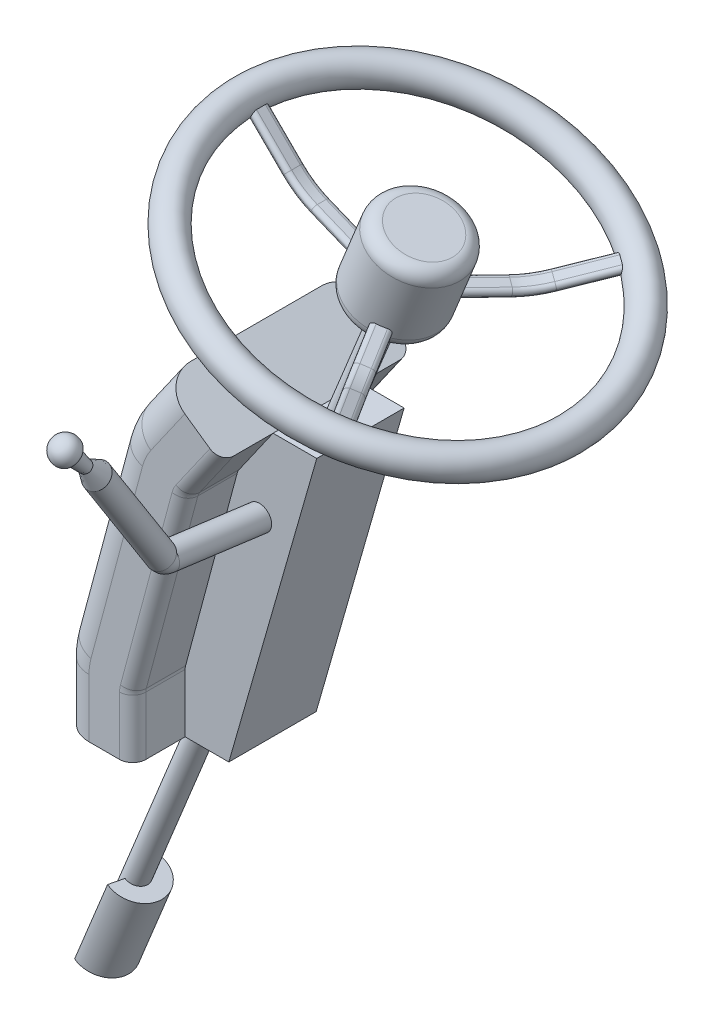
from build123d import *

# Parameters (mm, degrees)
EXTRUDE_THIN1_DEPTH      = 110
FILLET1_R                = 35
FILLET2_R                = 15
BOSS_EXTRUDE1_DEPTH      = 50
BOSS_EXTRUDE2_DEPTH      = 729
BOSS_EXTRUDE2_DEPTH_BACK = 150
SKETCH3_R                = 12.5
SKETCH4_R                = 17.5
FILLET3_R                = 15
EXTRUDE_THIN2_DEPTH      = 10
FILLET4_R                = 5
CIRPATTERN1_COUNT        = 3
FILLET4_OF_CIRPATTERN1_R = 5
BOSS_EXTRUDE3_START      = -10
BOSS_EXTRUDE3_DEPTH      = 100
SKETCH7_R                = 14


with BuildPart() as part:
    # Sketch1 → Extrude-Thin1 (new, symmetric)
    with BuildSketch(Plane.XY):
        with BuildLine():
            Line((0, 0), (0, 66.834750241))
            ThreePointArc((0, 66.834750241), (0.855513863, 79.887369463), (3.407417371, 92.716654752))
            Line((3.407417371, 92.716654752), (62.423620031, 312.968121546))
            ThreePointArc((62.423620031, 312.968121546), (68.385423956, 329.34804321), (77.100998231, 344.443860671))
            Line((77.100998231, 344.443860671), (116.001825782, 400))
            Line((116.001825782, 400), (185.629749547, 351.24600291))
            Line((185.629749547, 351.24600291), (146.728921995, 295.689863581))
            ThreePointArc((146.728921995, 295.689863581), (145.421585854, 293.425490962), (144.527315265, 290.968502712))
            Line((144.527315265, 290.968502712), (85.511112606, 70.717035918))
            ThreePointArc((85.511112606, 70.717035918), (85.128327079, 68.792643125), (85, 66.834750241))
            Line((85, 66.834750241), (85, 0))
            Line((85, 0), (0, 0))
        make_face()
    extrude(amount=EXTRUDE_THIN1_DEPTH, both=True)

    # Fillet1
    fillet1_edges = [part.edges().sort_by_distance(p)[0] for p in [
        (96.551412006, 372.221930336, 110),
        (0, 33.417375121, -110),
        (0.855513863, 79.887369463, -110),
        (32.915518701, 202.842388149, -110),
        (68.385423956, 329.34804321, -110),
        (96.551412006, 372.221930336, -110),
        (68.385423956, 329.34804321, 110),
        (32.915518701, 202.842388149, 110),
        (0.855513863, 79.887369463, 110),
        (0, 33.417375121, 110),
    ]]
    fillet(fillet1_edges, radius=FILLET1_R)

    # Fillet2
    fillet2_edges = [part.edges().sort_by_distance(p)[0] for p in [
        (85, 33.417375121, -110),
        (166.179335771, 323.467933246, -110),
        (85, 33.417375121, 110),
        (85.128327079, 68.792643125, 110),
        (115.019213935, 180.842769315, 110),
        (145.421585854, 293.425490962, 110),
        (166.179335771, 323.467933246, 110),
        (145.421585854, 293.425490962, -110),
        (115.019213935, 180.842769315, -110),
        (85.128327079, 68.792643125, -110),
    ]]
    fillet(fillet2_edges, radius=FILLET2_R)

    # Sketch2 → Boss-Extrude1 (add, symmetric)
    with BuildSketch(Plane.XY):
        with BuildLine():
            Line((185.629749547, 351.24600291), (146.728921995, 295.689863581))
            ThreePointArc((146.728921995, 295.689863581), (145.421585854, 293.425490962), (144.527315265, 290.968502712))
            Line((144.527315265, 290.968502712), (85.511112606, 70.717035918))
            ThreePointArc((85.511112606, 70.717035918), (85.128327079, 68.792643125), (85, 66.834750241))
            Line((85, 66.834750241), (85, 0))
            Line((85, 0), (135, 0))
            Line((135, 0), (235.629749547, 351.24600291))
            Line((235.629749547, 351.24600291), (185.629749547, 351.24600291))
        make_face()
    extrude(amount=BOSS_EXTRUDE1_DEPTH, both=True)

    # Sketch3 → Boss-Extrude2 (add, two sides: drawn at the far end of the back side and taken through both)
    with BuildSketch(Plane(origin=(156.321850052, 383.567696537, 0), x_dir=(-0.9260471966962699, 0.3774077231469702, 0), z_dir=(-0.3774077231469702, -0.9260471966962699, 0)).offset(-BOSS_EXTRUDE2_DEPTH_BACK)):
        with Locations(Location((-62.490134886, 0, 0), (0, 0, 180))):
            Circle(SKETCH3_R)
    extrude(amount=BOSS_EXTRUDE2_DEPTH + BOSS_EXTRUDE2_DEPTH_BACK)

    # Sketch4 → Revolve1 (revolve)
    with BuildSketch(Plane.XY):
        with Locations((104.462769574, 620.67442098)):
            Circle(SKETCH4_R)
        Polygon((270.801822756, 498.890516515), (224.499462922, 517.760902673), (262.240235236, 610.365622342), (308.542595071, 591.495236185), align=None)
    revolve(axis=Axis((274.099397866, 506.981792871, 0), (-0.37740772314697035, -0.9260471966962698, 0)))


with BuildPart() as revolve1_piece_1:
    # of the separate pieces the step leaves, piece 1, a body of its own (revolve1_pieces)
    add(part.part.solids().sort_by_distance((224.499462922, 517.760902673, 0))[0])

    # Fillet3
    fillet3_edges = [revolve1_piece_1.edges().sort_by_distance(p)[0] for p in [
        (354.844954906, 572.624850028, 0),
        (317.104182591, 480.020130358, 0),
    ]]
    fillet(fillet3_edges, radius=FILLET3_R)

    # Sketch6 → Boss-Extrude3 (add)
    with BuildSketch(Plane(origin=(-118.808380122, -291.520709854, 0), x_dir=(-0.9260471966962699, 0.3774077231469702, 0), z_dir=(-0.3774077231469702, -0.9260471966962699, 0)).offset(BOSS_EXTRUDE3_START)):
        with BuildLine():
            Line((-62.490134886, 0), (-57.280689556, 29.54423259))
            ThreePointArc((-57.280689556, 29.54423259), (-92.490134886, 0), (-57.280689556, -29.54423259))
            Line((-57.280689556, -29.54423259), (-62.490134886, 0))
        make_face()
    extrude(amount=-BOSS_EXTRUDE3_DEPTH)

    # Sweep1: sweep along a path in Sketch8
    with BuildLine(Plane(origin=(170, 0, 0), x_dir=(0, 0, -1), z_dir=(1, 0, 0))) as sweep1_path:
        Line((-50, 260), (-155.377539623, 274))
        ThreePointArc((-155.377539623, 274), (-159.443520275, 275.485343033), (-162.500817111, 278.549878667))
        Line((-162.500817111, 278.549878667), (-236.249097573, 394.614119911))
    # Sketch7 → Sweep1 (sweep)
    with BuildSketch(Plane.XY.offset(50)):
        with Locations((170, 260)):
            Circle(SKETCH7_R)
    sweep(path=sweep1_path.line)

    # Sketch10 → Revolve2 (revolve)
    with BuildSketch(Plane(origin=(170, 0, 0), x_dir=(0, 0, -1), z_dir=(1, 0, 0)), mode=Mode.PRIVATE) as revolve2_sk:
        with BuildLine():
            Line((-225.524475369, 403.613146447), (-243.956575071, 414.254924172))
            Line((-243.956575071, 414.254924172), (-261.249097573, 438.769586428))
            Line((-261.249097573, 438.769586428), (-258.853888932, 444.270765898))
            ThreePointArc((-258.853888932, 444.270765898), (-269.226288307, 452.205673408), (-281.887017861, 449.003275373))
            Line((-281.887017861, 449.003275373), (-236.249097573, 394.614119911))
            Line((-236.249097573, 394.614119911), (-225.524475369, 403.613146447))
        make_face()
    revolve(revolve2_sk.sketch.rotate(Axis((170, 394.614119911, 236.249097573), (0, 0.76604444311898, 0.642787609686537)), 270), axis=Axis((170, 394.614119911, 236.249097573), (0, 0.76604444311898, 0.642787609686537)))


with BuildPart() as revolve1_piece_2:
    # of the separate pieces the step leaves, piece 2, a body of its own (revolve1_pieces)
    add(part.part.solids().sort_by_distance((121.962769574, 620.67442098, 0))[0])

    # Sketch5 → Extrude-Thin2 (add, symmetric)
    with BuildSketch(Plane.XY):
        with BuildLine():
            Line((104.462769574, 620.67442098), (154.808758115, 570.67442098))
            ThreePointArc((154.808758115, 570.67442098), (170.09923185, 558.228176315), (187.534437755, 549.023764962))
            Line((187.534437755, 549.023764962), (243.089386561, 526.382514265))
            Line((243.089386561, 526.382514265), (246.863463792, 535.642986232))
            Line((246.863463792, 535.642986232), (191.308514987, 558.284236929))
            ThreePointArc((191.308514987, 558.284236929), (175.616829672, 566.568207146), (161.85540331, 577.769827345))
            Line((161.85540331, 577.769827345), (111.50941477, 627.769827345))
            Line((111.50941477, 627.769827345), (104.462769574, 620.67442098))
        make_face()
    extrude_thin2 = extrude(amount=EXTRUDE_THIN2_DEPTH, both=True)

    # Fillet4
    fillet4_edges = [revolve1_piece_2.edges().sort_by_distance(p)[0] for p in [
        (135.933236647, 589.420225774, -10),
        (170.09923185, 558.228176315, -10),
        (141.892815239, 597.595228186, -10),
        (175.616829672, 566.568207146, -10),
        (135.933236647, 589.420225774, 10),
        (215.311912158, 537.703139614, 10),
        (141.892815239, 597.595228186, 10),
        (219.08598939, 546.963611581, 10),
        (215.311912158, 537.703139614, -10),
        (219.08598939, 546.963611581, -10),
        (170.09923185, 558.228176315, 10),
        (175.616829672, 566.568207146, 10),
    ]]
    fillet(fillet4_edges, radius=FILLET4_R - 0.0001)  # a hair under: the kernel refuses the full size

    # CirPattern1: Extrude-Thin2 ×3 about axis
    cirpattern1_axis = Axis((57.868814232, -23.584259526, 0), (0.37740772314697174, 0.9260471966962692, 0))
    for i in range(1, CIRPATTERN1_COUNT):
        add(extrude_thin2.rotate(cirpattern1_axis, i * 360 / CIRPATTERN1_COUNT))

    # Fillet4 of CirPattern1
    fillet4_of_cirpattern1_edges = [revolve1_piece_2.edges().sort_by_distance(p)[0] for p in [
        (348.860821813, 502.642234977, 142.751115766),
        (322.725247364, 496.025907128, 105.15570206),
        (351.440038282, 512.194893708, 140.643606572),
        (325.517538365, 505.47662848, 103.45659144),
        (364.900429762, 496.105341461, 132.751115766),
        (315.058255801, 497.051820134, 52.18751977),
        (367.479646231, 505.658000191, 130.643606572),
        (318.832333032, 506.312292101, 52.18751977),
        (299.018647852, 503.58871365, 62.18751977),
        (302.792725083, 512.849185617, 62.18751977),
        (338.764855313, 489.489013612, 95.15570206),
        (341.557146313, 498.939734963, 93.45659144),
        (364.900429762, 496.105341461, -132.751115766),
        (338.764855313, 489.489013612, -95.15570206),
        (367.479646231, 505.658000191, -130.643606572),
        (341.557146313, 498.939734963, -93.45659144),
        (348.860821813, 502.642234977, -142.751115766),
        (299.018647852, 503.58871365, -62.18751977),
        (351.440038282, 512.194893708, -140.643606572),
        (302.792725083, 512.849185617, -62.18751977),
        (315.058255801, 497.051820134, -52.18751977),
        (318.832333032, 506.312292101, -52.18751977),
        (322.725247364, 496.025907128, -105.15570206),
        (325.517538365, 505.47662848, -103.45659144),
    ]]
    fillet(fillet4_of_cirpattern1_edges, radius=FILLET4_OF_CIRPATTERN1_R - 0.0001)  # a hair under: the kernel refuses the full size


solid = Compound([revolve1_piece_1.part, revolve1_piece_2.part])
